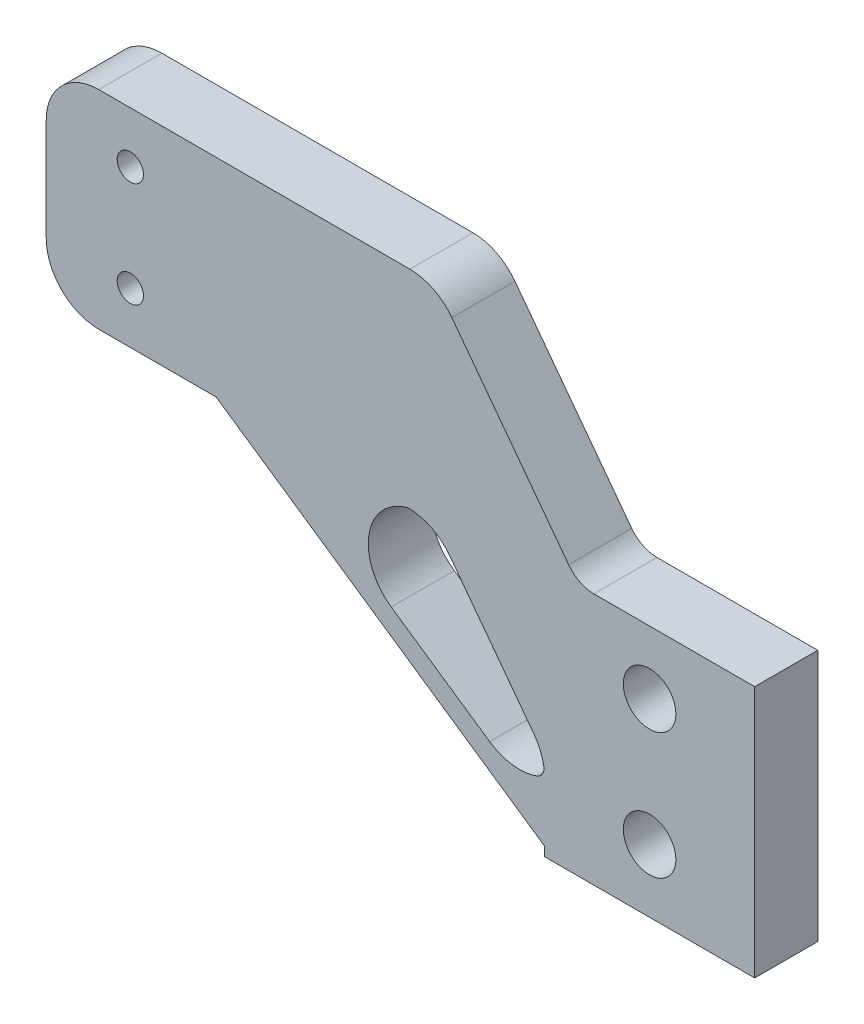
from build123d import *

# Parameters (mm, degrees)
SKETCH_1_R      = 2.5
SKETCH_1_R_2    = 1.25
EXTRUDE_1_DEPTH = 6
FILLET_1_R      = 5
FILLET_2_R      = 1


with BuildPart() as part:
    # 草图1 → 凸台-拉伸1 (new body)
    with BuildSketch(Plane.XY):
        with BuildLine():
            Line((1.500025947, -1.999165895), (12.605850611, -16.800500463))
            ThreePointArc((12.605850611, -16.800500463), (13.664114192, -17.683421453), (15.005475182, -18))
            Line((15.005475182, -18), (30.306366751, -18))
            Line((30.306366751, -18), (30.306366751, -32.6148543))
            Line((30.306366751, -32.6148543), (30.306366751, -42))
            Line((30.306366751, -42), (10.306366751, -42))
            Line((10.306366751, -42), (10.306366751, -41.12210437))
            Line((10.306366751, -41.12210437), (-20.930018343, -19.75))
            Line((-20.930018343, -19.75), (-32.093633249, -19.75))
            ThreePointArc((-32.093633249, -19.75), (-35.629167155, -18.285533906), (-37.093633249, -14.75))
            Line((-37.093633249, -14.75), (-37.093633249, -5))
            ThreePointArc((-37.093633249, -5), (-35.629167155, -1.464466094), (-32.093633249, 0))
            Line((-32.093633249, 0), (-2.499348338, 0))
            ThreePointArc((-2.499348338, 0), (-0.263746688, -0.527630912), (1.500025947, -1.999165895))
        make_face()
        with Locations((20.306366751, -36)):
            Circle(SKETCH_1_R, mode=Mode.SUBTRACT)
        with Locations((20.306366751, -24)):
            Circle(SKETCH_1_R, mode=Mode.SUBTRACT)
        with Locations((-29.093633249, -4.875)):
            Circle(SKETCH_1_R_2, mode=Mode.SUBTRACT)
        with Locations((-29.093633249, -14.875)):
            Circle(SKETCH_1_R_2, mode=Mode.SUBTRACT)
        with BuildLine():
            Line((9.305741036, -32.39670638), (1.316615651, -21.749165895))
            ThreePointArc((1.316615651, -21.749165895), (-0.447156984, -20.277630912), (-2.682758634, -19.75))
            Line((-2.682758634, -19.75), (-17.388195941, -19.75))
            Line((-17.388195941, -19.75), (10.306366751, -38.698770243))
            Line((10.306366751, -38.698770243), (10.306366751, -35.397540485))
            ThreePointArc((10.306366751, -35.397540485), (10.049618348, -33.815907061), (9.305741036, -32.39670638))
        make_face(mode=Mode.SUBTRACT)
    extrude(amount=EXTRUDE_1_DEPTH)

    # 圆角1
    # the kernel refuses this fillet: 5 mm, written as the material it adds along each edge
    with BuildSketch(Plane(origin=(10.306366751, -38.698770243, 0), x_dir=(0, 1, 0), z_dir=(0, 0, 1))) as fillet_1_piece_1:
        with BuildLine():
            CenterArc((7.693275838, 2.389546239), FILLET_1_R, 145.619854071, 62.929086432)
            Line((3.566729735, 5.2129515), (3.484198813, 5.269419605))
            Line((3.484198813, 5.269419605), (-0.082530922, 0.056468105))
            Line((-0.082530922, 0.056468105), (0, -0.1))
            ThreePointArc((0, -0.1), (1.650614879, -0.1), (3.213388836, -0.047790925))
            Line((3.213388836, -0.047790925), (3.301229757, 0))
        make_face()
    extrude(amount=6)
    with BuildSketch(Plane(origin=(-17.388195941, -19.75, 0), x_dir=(0.8253092204879542, -0.5646810520794596, 0), z_dir=(0, 0, 1))) as fillet_1_piece_2:
        with BuildLine():
            CenterArc((15.8894472, 5), FILLET_1_R, 138.640890522, 131.359109478)
            Line((12.136533001, 8.30388181), (12.061474717, 8.369959446))
            ThreePointArc((12.061474717, 8.369959446), (6.011798395, 4.234471827), (-0.056468105, 0.082530922))
            Line((-0.056468105, 0.082530922), (0, -0.1))
            Line((0, -0.1), (15.8894472, -0.1))
            Line((15.8894472, -0.1), (15.8894472, 0))
        make_face()
    extrude(amount=6)

    # 圆角2
    fillet_2_edges = [part.edges().sort_by_distance(p)[0] for p in [
        (10.306366751, -35.397540485, 3),
    ]]
    fillet(fillet_2_edges, radius=FILLET_2_R)


solid = part.part
